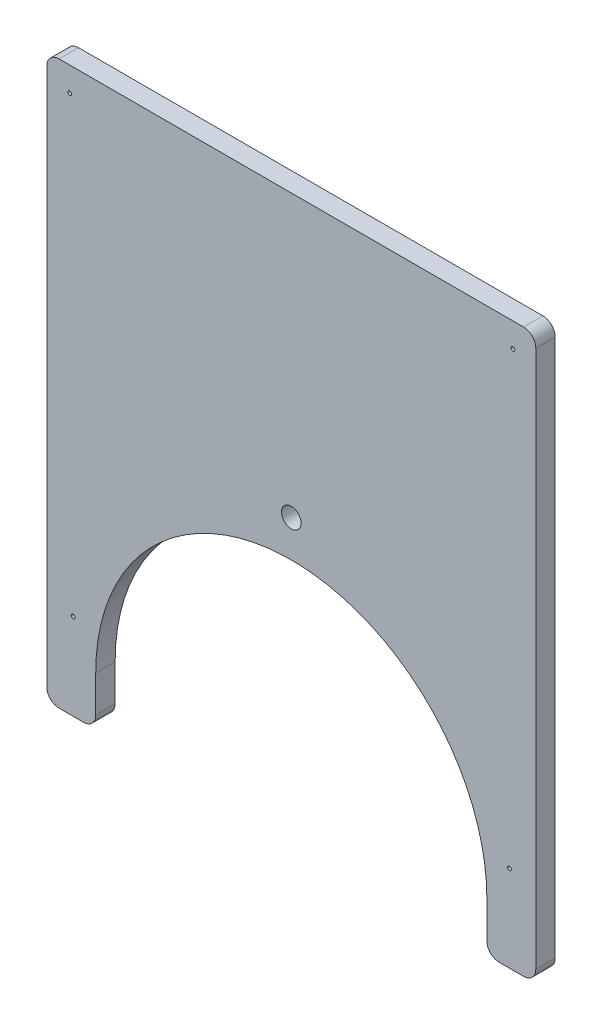
from build123d import *

# Parameters (mm, degrees)
SKETCH1_W           = 400
SKETCH1_H           = 460
BOSS_EXTRUDE1_DEPTH = 15.875
CUT_EXTRUDE1_DEPTH  = 306.208151308
FILLET1_R           = 10
SKETCH3_R           = 8
CUT_EXTRUDE2_DEPTH  = 306.208151308
SKETCH5_R           = 1.5875
CUT_EXTRUDE3_DEPTH  = 306.208151308


with BuildPart() as part:
    # Sketch1 → Boss-Extrude1 (new body)
    with BuildSketch(Plane.XY):
        Rectangle(SKETCH1_W, SKETCH1_H)
    extrude(amount=-BOSS_EXTRUDE1_DEPTH)

    # Sketch2 → Cut-Extrude1 (cut, through all)
    with BuildSketch(Plane.XY):
        with BuildLine():
            Line((160, -230), (160, -190))
            ThreePointArc((160, -190), (0, -30), (-160, -190))
            Line((-160, -190), (-160, -230))
            Line((-160, -230), (160, -230))
        make_face()
    extrude(amount=-CUT_EXTRUDE1_DEPTH, mode=Mode.SUBTRACT)

    # Fillet1
    fillet1_edges = [part.edges().sort_by_distance(p)[0] for p in [
        (-160, -230, -7.9375),
        (-200, -230, -7.9375),
        (160, -230, -7.9375),
        (200, -230, -7.9375),
        (-200, 230, -7.9375),
        (200, 230, -7.9375),
    ]]
    fillet(fillet1_edges, radius=FILLET1_R)

    # Sketch3 → Cut-Extrude2 (cut, through all)
    with BuildSketch(Plane.XY):
        Circle(SKETCH3_R)
    extrude(amount=-CUT_EXTRUDE2_DEPTH, mode=Mode.SUBTRACT)

    # Sketch5 → Cut-Extrude3 (cut, through all)
    with BuildSketch(Plane.XY):
        with Locations((-181.2487, 210.112)):
            Circle(SKETCH5_R)
        with Locations((-178.461, -159.2706)):
            Circle(SKETCH5_R)
    cut_extrude3 = extrude(amount=-CUT_EXTRUDE3_DEPTH, mode=Mode.SUBTRACT)

    # Mirror1: Cut-Extrude3 across plane
    add(cut_extrude3.mirror(Plane(origin=(0, 0, 0), x_dir=(0, 0, 1), z_dir=(1, 0, 0))), mode=Mode.SUBTRACT)


solid = part.part
